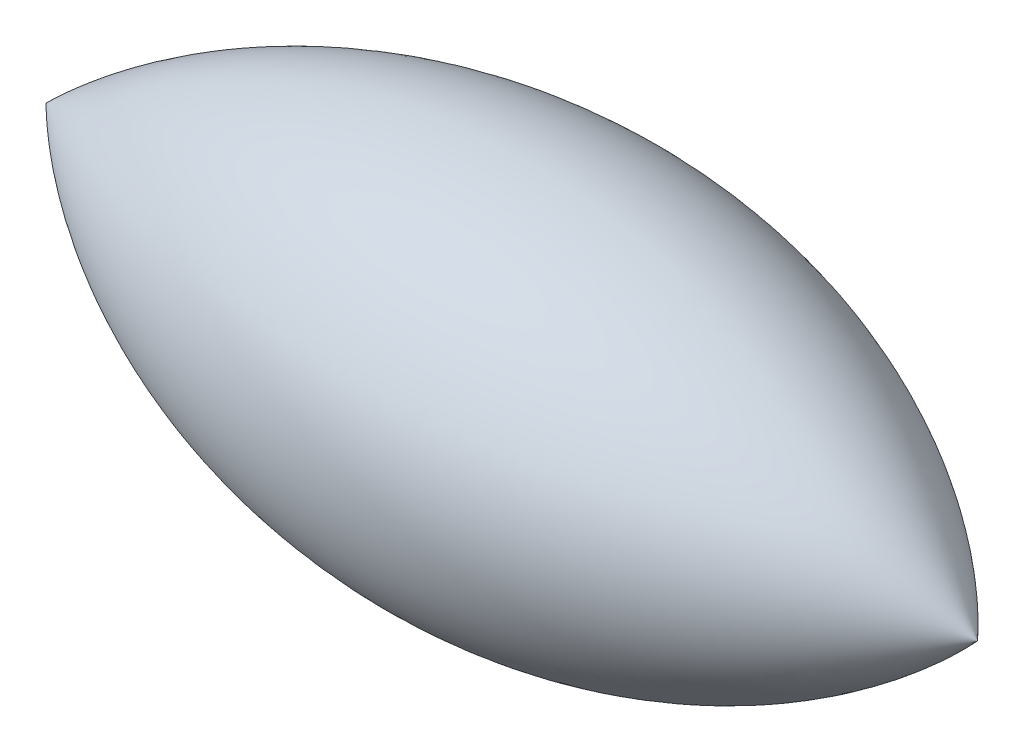
from build123d import *


with BuildPart() as part:
    # Sketch1 → Revolve1 (revolve)
    with BuildSketch(Plane.XY):
        with BuildLine():
            Line((-417.531060972, 136.303922145), (375.817429383, 136.303922145))
            add(Edge.make_bspline(
                [(-417.531060972, 136.303922145), (-206.584731474, 344.418140325), (168.136323052, 360.284710334), (375.817429383, 136.303922145)],
                knots=[0, 0, 0, 0, 1, 1, 1, 1], degree=3))
        make_face()
    revolve(axis=Axis((-417.531060972, 136.303922145, 0), (1, 0, 0)))


solid = part.part
